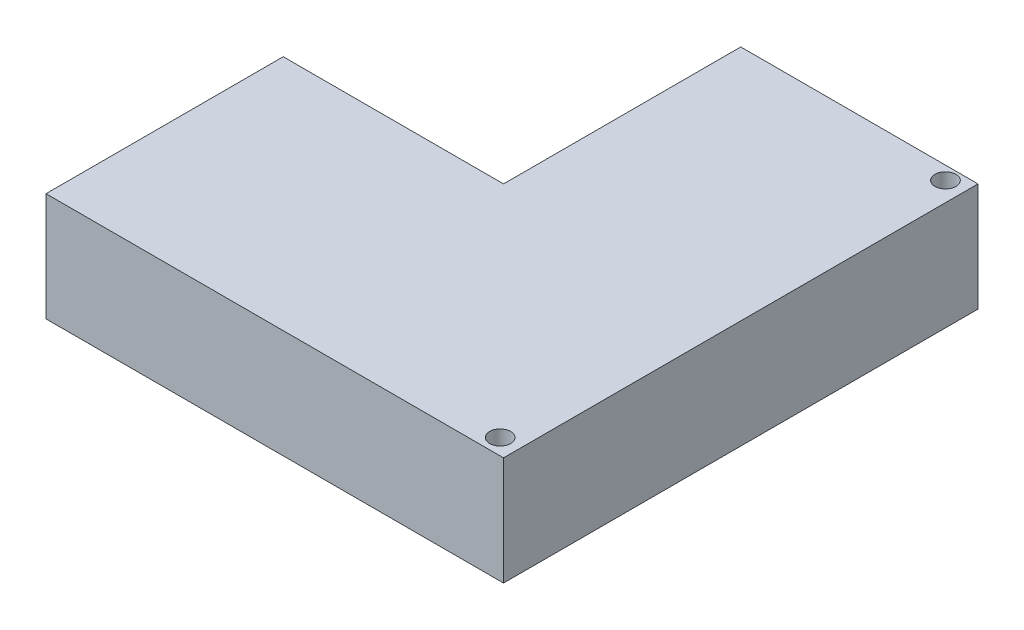
from build123d import *

# Parameters (mm, degrees)
BOSS_EXTRUDE1_DEPTH = 8
MOVE_FACE1_BY       = 23
SKETCH3_R           = 1.55
CUT_EXTRUDE1_DEPTH  = 96.016230125


with BuildPart() as part:
    # Sketch2 → Boss-Extrude1 (new, symmetric)
    with BuildSketch(Plane.XZ):
        Polygon((-13.796187154, 46.508213699), (-13.796187154, -23.491786301), (-48.796187154, -23.491786301), (-48.796187154, 11.508213699), (-104.296187154, 11.508213699), (-104.296187154, 46.508213699), align=None)
    extrude(amount=BOSS_EXTRUDE1_DEPTH, both=True)

    # Move Face1: a face moved inward by 23.0
    extrude(part.faces().sort_by_distance((-104.296187154, 0, 29.008213699))[0], amount=MOVE_FACE1_BY, dir=(1, 0, 0), mode=Mode.SUBTRACT)

    # Sketch3 → Cut-Extrude1 (cut, through all)
    with BuildSketch(Plane.XZ.offset(8)):
        with Locations((-16.646187154, 44.158213699)):
            Circle(SKETCH3_R)
        with Locations((-16.646187154, -21.541786301)):
            Circle(SKETCH3_R)
    extrude(amount=-CUT_EXTRUDE1_DEPTH, mode=Mode.SUBTRACT)


solid = part.part
